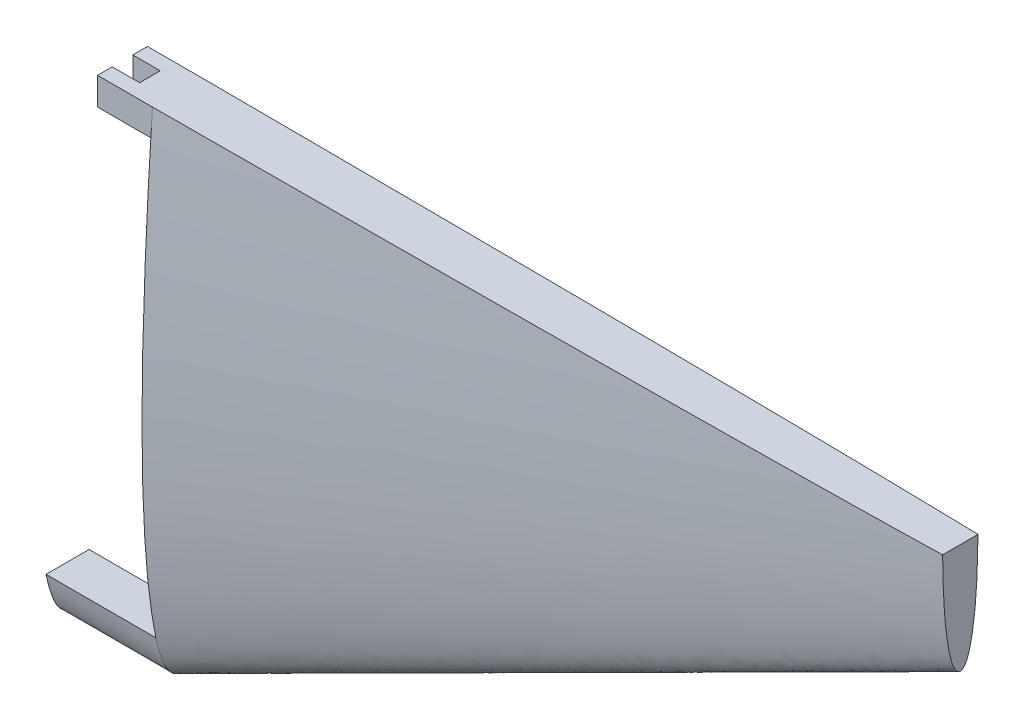
from build123d import *

# Parameters (mm, degrees)
CUT_EXTRUDE_1_DEPTH = 100
EXTRUDE_1_DEPTH     = 4
EXTRUDE_2_DEPTH     = 8
CUT_EXTRUDE_2_DEPTH = 8
CUT_EXTRUDE_3_DEPTH = 2


with BuildPart() as part:
    # 边界1: read off the stored shape, not the designer's step
    # 边界1: loft between two sections, ruled curve by curve
    other_1_from = [
        Edge.make_bspline([(57, 114.4, 0), (57, 114.4, -0.001820958), (57, 114.352907673, -0.005462209), (57, 114.320029662, -0.010907062), (57, 114.249222739, -0.019878571), (57, 114.156548338, -0.032132456), (57, 114.034213823, -0.047441735), (57, 113.88654175, -0.065607247), (57, 113.370012427, -0.127548617), (57, 112.137163028, -0.259027461), (57, 110.501004902, -0.411740073), (57, 108.197187, -0.609641558), (57, 105.449560235, -0.823147067), (57, 101.925918142, -1.053296025), (57, 98.277494458, -1.228543839), (57, 95.54587026, -1.292002462), (57, 93.784319833, -1.289907394), (57, 92.706452955, -1.275561059), (57, 91.44341688, -1.237574119), (57, 89.861087122, -1.144036077), (57, 88.633959438, -1.015878162), (57, 87.732221341, -0.870007472), (57, 87.291174629, -0.784346378), (57, 86.904270346, -0.693141039), (57, 86.573320845, -0.593334554), (57, 86.278541554, -0.47481733), (57, 86.064886191, -0.349405025), (57, 85.915497173, -0.21755301), (57, 85.83987064, -0.125468872), (57, 85.804696915, -0.046646811), (57, 85.798464788, 0), (57, 85.804696915, 0.046646811), (57, 85.83987064, 0.125468872), (57, 85.915497173, 0.21755301), (57, 86.064886191, 0.349405025), (57, 86.278541554, 0.47481733), (57, 86.573320845, 0.593334554), (57, 86.904270346, 0.693141039), (57, 87.291174629, 0.784346378), (57, 87.732221341, 0.870007472), (57, 88.633959438, 1.015878162), (57, 89.861087122, 1.144036077), (57, 91.44341688, 1.237574119), (57, 92.706452955, 1.275561059), (57, 93.784319833, 1.289907394), (57, 95.54587026, 1.292002462), (57, 98.277494458, 1.228543839), (57, 101.925918142, 1.053296025), (57, 105.449560235, 0.823147067), (57, 108.197187, 0.609641558), (57, 110.501004902, 0.411740073), (57, 112.137163028, 0.259027461), (57, 113.370012427, 0.127548617), (57, 113.88654175, 0.065607247), (57, 114.034213823, 0.047441735), (57, 114.156548338, 0.032132456), (57, 114.249222739, 0.019878571), (57, 114.320029662, 0.010907062), (57, 114.352907673, 0.005462209), (57, 114.4, 0.001820958), (57, 114.4, 0)], [0, 0, 0, 0, 0.000711186, 0.001422112, 0.002133252, 0.004251581, 0.006369198, 0.008487526, 0.011973078, 0.033316573, 0.072750533, 0.097133325, 0.153150736, 0.215572756, 0.28012949, 0.342436877, 0.357160037, 0.371419983, 0.398301185, 0.422640862, 0.45355583, 0.462206438, 0.469975829, 0.476836911, 0.482800105, 0.487877314, 0.493276037, 0.495568649, 0.498179926, 0.499405099, 0.5, 0.500594901, 0.501820074, 0.504431351, 0.506723963, 0.512122686, 0.517199895, 0.523163089, 0.530024171, 0.537793562, 0.54644417, 0.577359138, 0.601698815, 0.628580017, 0.642839963, 0.657563123, 0.71987051, 0.784427244, 0.846849264, 0.902866675, 0.927249467, 0.966683427, 0.988026922, 0.991512474, 0.993630802, 0.995748419, 0.997866748, 0.998577888, 0.999288814, 1, 1, 1, 1], 3),
    ]
    other_1_to = [
        Edge.make_bspline([(0, 114.4, 0), (0, 114.4, -0.003641916), (0, 114.305815345, -0.010924418), (0, 114.240059323, -0.021814123), (0, 114.098445477, -0.039757143), (0, 113.913096675, -0.064264912), (0, 113.668427647, -0.09488347), (0, 113.3730835, -0.131214495), (0, 112.340024854, -0.255097235), (0, 109.874326056, -0.518054923), (0, 106.602009805, -0.823480147), (0, 101.994374001, -1.219283117), (0, 96.499120471, -1.646294135), (0, 89.451836285, -2.106592051), (0, 82.154988917, -2.457087677), (0, 76.69174052, -2.584004925), (0, 73.168639667, -2.579814789), (0, 71.01290591, -2.551122119), (0, 68.486833761, -2.475148238), (0, 65.322174244, -2.288072154), (0, 62.867918876, -2.031756324), (0, 61.064442682, -1.740014943), (0, 60.182349259, -1.568692756), (0, 59.408540691, -1.386282078), (0, 58.746641691, -1.186669108), (0, 58.157083107, -0.949634659), (0, 57.729772382, -0.698810051), (0, 57.430994345, -0.43510602), (0, 57.27974128, -0.250937745), (0, 57.209393829, -0.093293621), (0, 57.196929575, 0), (0, 57.209393829, 0.093293621), (0, 57.27974128, 0.250937745), (0, 57.430994345, 0.43510602), (0, 57.729772382, 0.698810051), (0, 58.157083107, 0.949634659), (0, 58.746641691, 1.186669108), (0, 59.408540691, 1.386282078), (0, 60.182349259, 1.568692756), (0, 61.064442682, 1.740014943), (0, 62.867918876, 2.031756324), (0, 65.322174244, 2.288072154), (0, 68.486833761, 2.475148238), (0, 71.01290591, 2.551122119), (0, 73.168639667, 2.579814789), (0, 76.69174052, 2.584004925), (0, 82.154988917, 2.457087677), (0, 89.451836285, 2.106592051), (0, 96.499120471, 1.646294135), (0, 101.994374001, 1.219283117), (0, 106.602009805, 0.823480147), (0, 109.874326056, 0.518054923), (0, 112.340024854, 0.255097235), (0, 113.3730835, 0.131214495), (0, 113.668427647, 0.09488347), (0, 113.913096675, 0.064264912), (0, 114.098445477, 0.039757143), (0, 114.240059323, 0.021814123), (0, 114.305815345, 0.010924418), (0, 114.4, 0.003641916), (0, 114.4, 0)], [0, 0, 0, 0, 0.000711186, 0.001422112, 0.002133252, 0.004251581, 0.006369198, 0.008487526, 0.011973078, 0.033316573, 0.072750533, 0.097133325, 0.153150736, 0.215572756, 0.28012949, 0.342436877, 0.357160037, 0.371419983, 0.398301185, 0.422640862, 0.45355583, 0.462206438, 0.469975829, 0.476836911, 0.482800105, 0.487877314, 0.493276037, 0.495568649, 0.498179926, 0.499405099, 0.5, 0.500594901, 0.501820074, 0.504431351, 0.506723963, 0.512122686, 0.517199895, 0.523163089, 0.530024171, 0.537793562, 0.54644417, 0.577359138, 0.601698815, 0.628580017, 0.642839963, 0.657563123, 0.71987051, 0.784427244, 0.846849264, 0.902866675, 0.927249467, 0.966683427, 0.988026922, 0.991512474, 0.993630802, 0.995748419, 0.997866748, 0.998577888, 0.999288814, 1, 1, 1, 1], 3),
    ]
    other_1 = Solid(Shell([*[Face.make_surface_from_curves(other_1_from[k], other_1_to[k]) for k in range(1)], Face(Wire(other_1_from)), Face(Wire(other_1_to))]))
    add(other_1)

    # 草图11 → 切除-拉伸1 (cut)
    with BuildSketch(Plane.ZY):
        with BuildLine():
            add(Edge.make_bspline(
                [(1.818517356, 93.791415019), (1.753373518, 94.776013938), (1.536110859, 97.917081629), (1.219283117, 101.994374001), (0.823480147, 106.602009805), (0.518054923, 109.874326056), (0.255097235, 112.340024854), (0.131214495, 113.3730835), (0.09488347, 113.668427647), (0.064264912, 113.913096675), (0.039757143, 114.098445477), (0.021814123, 114.240059323), (0.010924418, 114.305815345), (0.003641916, 114.4), (0, 114.4)],
                knots=[0.821280205, 0.821280205, 0.821280205, 0.821280205, 0.846849264, 0.902866675, 0.927249467, 0.966683427, 0.988026922, 0.991512474, 0.993630802, 0.995748419, 0.997866748, 0.998577888, 0.999288814, 1, 1, 1, 1], degree=3))
            Line((0, 114.4), (0, 93.791415019))
            Line((0, 93.791415019), (1.818517356, 93.791415019))
        make_face()
        with BuildLine():
            Line((0, 93.791415019), (0, 114.4))
            add(Edge.make_bspline(
                [(0, 114.4), (-0.003641916, 114.4), (-0.010924418, 114.305815345), (-0.021814123, 114.240059323), (-0.039757143, 114.098445477), (-0.064264912, 113.913096675), (-0.09488347, 113.668427647), (-0.131214495, 113.3730835), (-0.255097235, 112.340024854), (-0.518054923, 109.874326056), (-0.823480147, 106.602009805), (-1.219283117, 101.994374001), (-1.536110859, 97.917081629), (-1.753373518, 94.776013938), (-1.818517356, 93.791415019)],
                knots=[0, 0, 0, 0, 0.000711186, 0.001422112, 0.002133252, 0.004251581, 0.006369198, 0.008487526, 0.011973078, 0.033316573, 0.072750533, 0.097133325, 0.153150736, 0.178719795, 0.178719795, 0.178719795, 0.178719795], degree=3))
            Line((-1.818517356, 93.791415019), (0, 93.791415019))
        make_face()
    extrude(amount=-CUT_EXTRUDE_1_DEPTH, mode=Mode.SUBTRACT)

    # 草图11<4> → 凸台-拉伸1 (add)
    with BuildSketch(Plane.ZY):
        with BuildLine():
            Line((1.818517355, 93.791415019), (0, 93.791415019))
            Line((0, 93.791415019), (0, 91.791415019))
            Line((0, 91.791415019), (1.946673224, 91.791415019))
            add(Edge.make_bspline(
                [(1.946673224, 91.791415019), (1.905372431, 92.4581713), (1.862619998, 93.124837556), (1.818517355, 93.791415019)],
                knots=[0.803969849, 0.803969849, 0.803969849, 0.803969849, 0.821280205, 0.821280205, 0.821280205, 0.821280205], degree=3))
        make_face()
        with BuildLine():
            Line((0, 91.791415019), (0, 93.791415019))
            Line((0, 93.791415019), (-1.818517355, 93.791415019))
            add(Edge.make_bspline(
                [(-1.818517355, 93.791415019), (-1.862619998, 93.124837556), (-1.905372431, 92.4581713), (-1.946673224, 91.791415019)],
                knots=[0.178719795, 0.178719795, 0.178719795, 0.178719795, 0.196030151, 0.196030151, 0.196030151, 0.196030151], degree=3))
            Line((-1.946673224, 91.791415019), (0, 91.791415019))
        make_face()
        with BuildLine():
            Line((1.818517355, 93.791415019), (0, 93.791415019))
            Line((0, 93.791415019), (0, 91.791415019))
            Line((0, 91.791415019), (1.946673224, 91.791415019))
            add(Edge.make_bspline(
                [(1.946673224, 91.791415019), (1.905372431, 92.4581713), (1.862619998, 93.124837556), (1.818517355, 93.791415019)],
                knots=[0.803969849, 0.803969849, 0.803969849, 0.803969849, 0.821280205, 0.821280205, 0.821280205, 0.821280205], degree=3))
        make_face()
        with BuildLine():
            Line((0, 91.791415019), (0, 93.791415019))
            Line((0, 93.791415019), (-1.818517355, 93.791415019))
            add(Edge.make_bspline(
                [(-1.818517355, 93.791415019), (-1.862619998, 93.124837556), (-1.905372431, 92.4581713), (-1.946673224, 91.791415019)],
                knots=[0.178719795, 0.178719795, 0.178719795, 0.178719795, 0.196030151, 0.196030151, 0.196030151, 0.196030151], degree=3))
            Line((-1.946673224, 91.791415019), (0, 91.791415019))
        make_face()
    extrude(amount=EXTRUDE_1_DEPTH)

    # 草图12 → 凸台-拉伸2 (add)
    with BuildSketch(Plane.ZY):
        with BuildLine():
            Line((-1.566736341, 60.2), (1.566736341, 60.2))
            add(Edge.make_bspline(
                [(-1.566736341, 60.2), (-1.5631196, 60.183072108), (-1.503847378, 59.907267174), (-1.386282078, 59.408540691), (-1.186669108, 58.746641691), (-0.949634659, 58.157083107), (-0.698810051, 57.729772382), (-0.43510602, 57.430994345), (-0.250937745, 57.27974128), (-0.093293621, 57.209393829), (0, 57.196929575), (0.093293621, 57.209393829), (0.250937745, 57.27974128), (0.43510602, 57.430994345), (0.698810051, 57.729772382), (0.949634659, 58.157083107), (1.186669108, 58.746641691), (1.386282078, 59.408540691), (1.503847378, 59.907267174), (1.5631196, 60.183072108), (1.566736341, 60.2)],
                knots=[0.469527304, 0.469527304, 0.469527304, 0.469527304, 0.469975829, 0.476836911, 0.482800105, 0.487877314, 0.493276037, 0.495568649, 0.498179926, 0.499405099, 0.5, 0.500594901, 0.501820074, 0.504431351, 0.506723963, 0.512122686, 0.517199895, 0.523163089, 0.530024171, 0.530472696, 0.530472696, 0.530472696, 0.530472696], degree=3))
        make_face()
    extrude(amount=EXTRUDE_2_DEPTH)

    # 草图13 → 切除-拉伸2 (cut)
    with BuildSketch(Plane.XZ.offset(-91.791415019)):
        Polygon((-4, 0.75), (-4, 0), (-4, -0.75), (-2, -0.75), (-2, 0.75), align=None)
    extrude(amount=-CUT_EXTRUDE_2_DEPTH, mode=Mode.SUBTRACT)

    # 草图14 → 切除-拉伸3 (cut)
    with BuildSketch(Plane(origin=(0, 93.791415019, 0), x_dir=(1, 0, 0), z_dir=(0, 1, 0))):
        Polygon((0, 8.839262419), (0, 1.818517355), (-4, 1.818517355), (-8.303964659, 1.818517355), (-8.507605429, 8.583151707), align=None)
        Polygon((-8.303964659, -7.097187561), (0, -7.097187561), (0, -1.818517354), (-4, -1.818517355), (-8.303964659, -1.818517355), align=None)
    extrude(amount=-CUT_EXTRUDE_3_DEPTH, mode=Mode.SUBTRACT)


solid = part.part
